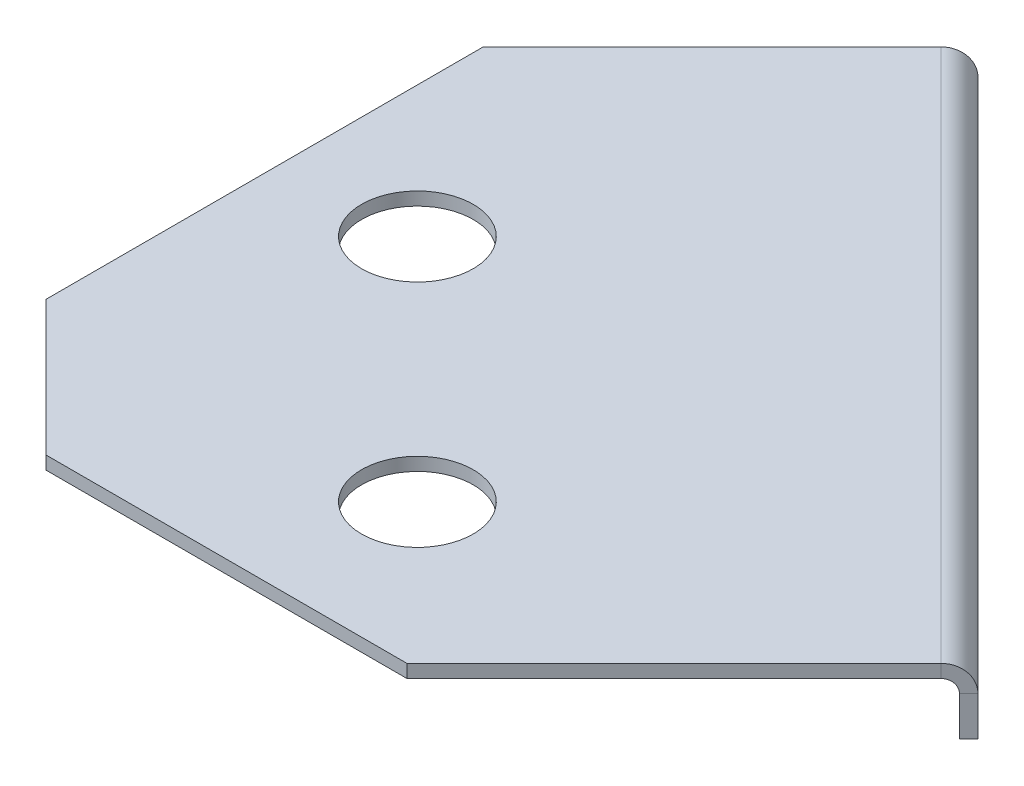
from build123d import *

# Parameters (mm, degrees)
BASE_FLANGE1_DEPTH           = 0.2
EDGE_FLANGE1_STRIP_W         = 1.2
EDGE_FLANGE1_STRIP_H         = 0.2
EDGE_FLANGE1_STRIP_CUT_DEPTH = 11.5
EDGE_FLANGE1_DEPTH           = 11.5
F_1_7_1_7_DIAMETER_HOLE1_D   = 1.7


# Sheet-metal steps are written as plain solids
with BuildPart() as part:
    # Sketch1 → Base-Flange1 (new body)
    with BuildSketch(Plane(origin=(0, 0, 0), x_dir=(1, 0, 0), z_dir=(0, 1, 0))):
        Polygon((-4.873652989, 5.318528304), (-8.5, 1.692181293), (-8.5, -4.967910087), (-6.446655485, -7.021254602), (-0.949979928, -7.021254602), (3.258074995, -2.813199679), align=None)
    extrude(amount=-BASE_FLANGE1_DEPTH)

    # Edge-Flange1 strip (across the edge) → Edge-Flange1 strip cut (cut)
    with BuildSketch(Plane(origin=(-4.873652989, -0.2, -5.318528304), x_dir=(-0.7071067811865558, -3.4914813388431334e-15, 0.7071067811865392), z_dir=(0.7071067811865392, 0, 0.7071067811865558))):
        with Locations((-0.4, -0.1)):
            Rectangle(EDGE_FLANGE1_STRIP_W, EDGE_FLANGE1_STRIP_H)
    extrude(amount=EDGE_FLANGE1_STRIP_CUT_DEPTH, mode=Mode.SUBTRACT)

    # Edge-Flange1 section (across the edge) → Edge-Flange1 (add)
    with BuildSketch(Plane(origin=(-4.873652989, -0.2, -5.318528304), x_dir=(-0.7071067811865558, -3.4914813388431334e-15, 0.7071067811865392), z_dir=(0.7071067811865392, 0, 0.7071067811865558))):
        with BuildLine():
            Line((-0.2, 0.2), (-0.2, 0.8))
            Line((-0.2, 0.8), (0, 0.8))
            Line((0, 0.8), (0, 0.2))
            ThreePointArc((0, 0.2), (0.058578644, 0.058578644), (0.2, 0))
            Line((0.2, 0), (0.2, -0.2))
            ThreePointArc((0.2, -0.2), (-0.082842712, -0.082842712), (-0.2, 0.2))
        make_face()
    extrude(amount=EDGE_FLANGE1_DEPTH)

    # Ø1.7 (1.7) Diameter Hole1 (through all)
    with Locations(Plane(origin=(0, 0, 0), x_dir=(1, 0, 0), z_dir=(0, 1, 0))):
        with Locations((-6.5, -1.311055838), (-3, -4.811055838)):
            Hole(F_1_7_1_7_DIAMETER_HOLE1_D / 2)


solid = part.part
